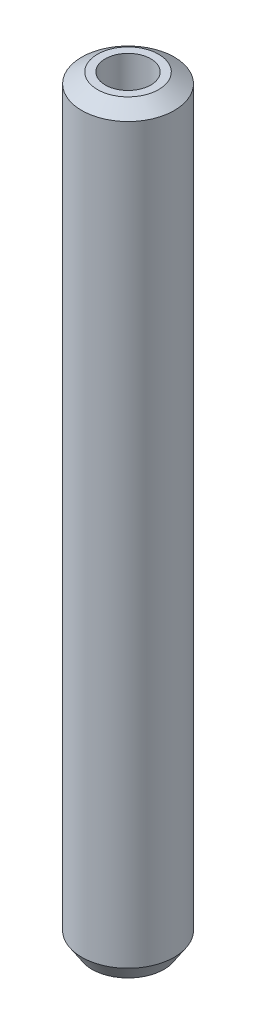
from build123d import *
from OCP.BRepFilletAPI import BRepFilletAPI_MakeChamfer

# Parameters (mm, degrees)
SKETCH1_R           = 20
BOSS_EXTRUDE1_DEPTH = 327.991136578
SKETCH2_R           = 9.832076021
CUT_EXTRUDE1_DEPTH  = 330.208422848
CHAMFER1_SIZE       = 4.43439637
CHAMFER1_SIZE2      = 6.774368122


with BuildPart() as part:
    # Sketch1 → Boss-Extrude1 (new body)
    with BuildSketch(Plane(origin=(0, 0, 0), x_dir=(1, 0, 0), z_dir=(0, 1, 0))):
        Circle(SKETCH1_R)
    extrude(amount=BOSS_EXTRUDE1_DEPTH)

    # Sketch2 → Cut-Extrude1 (cut, through all)
    with BuildSketch(Plane(origin=(0, 0, 0), x_dir=(1, 0, 0), z_dir=(0, 1, 0))):
        Circle(SKETCH2_R)
    extrude(amount=CUT_EXTRUDE1_DEPTH, mode=Mode.SUBTRACT)

    # Chamfer1: one chamfer whose edges measure the first distance from different faces: ONE call of the kernel's chamfer builder (chamfer() names one face for all edges)
    chamfer1_edges_1 = [part.edges().sort_by_distance(p)[0] for p in [
        (-20, 327.991136578, 0),
    ]]
    chamfer1_side_1 = [part.faces().sort_by_distance(p)[0] for p in [
        (-20, 163.995568289, 0),
    ]]
    chamfer1_edges_2 = [part.edges().sort_by_distance(p)[0] for p in [
        (-20, 0, 0),
    ]]
    chamfer1_side_2 = [part.faces().sort_by_distance(p)[0] for p in [
        (-19.434314575, 0, 0),
    ]]
    chamfer1 = BRepFilletAPI_MakeChamfer(part.part.solid().wrapped)
    for e in chamfer1_edges_1:
        chamfer1.Add(CHAMFER1_SIZE, CHAMFER1_SIZE2, e.wrapped, chamfer1_side_1[0].wrapped)  # the first distance lies on this face
    for e in chamfer1_edges_2:
        chamfer1.Add(CHAMFER1_SIZE, CHAMFER1_SIZE2, e.wrapped, chamfer1_side_2[0].wrapped)  # the first distance lies on this face
    add(Compound.cast(chamfer1.Shape()), mode=Mode.REPLACE)


solid = part.part
